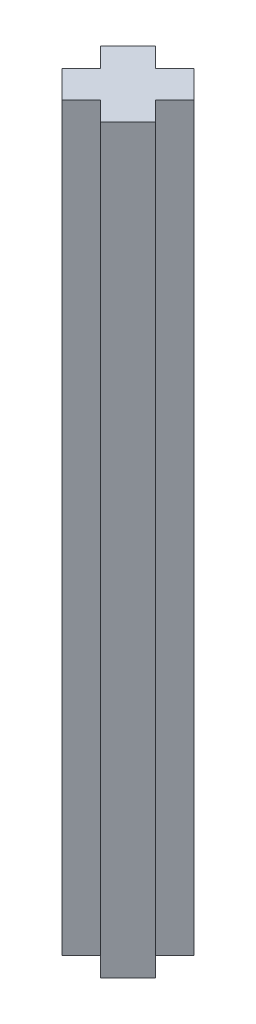
from build123d import *

# Parameters (mm, degrees)
BOSS_EXTRUDE1_DEPTH = 69.02173913
SCALE1_SCALE        = 0.92


with BuildPart() as part:
    # Sketch1 → Boss-Extrude1 (new body)
    with BuildSketch(Plane(origin=(0, 0, 0), x_dir=(1, 0, 0), z_dir=(0, 1, 0))):
        Polygon((-0.6269783, 2.91618698), (-2.423029524, 4.712238204), (-4.963029524, 2.172238204), (-3.1669783, 0.37618698), (-4.963029524, -1.419864244), (-2.423029524, -3.959864244), (-0.6269783, -2.16381302), (1.169072924, -3.959864244), (3.709072924, -1.419864244), (1.9130217, 0.37618698), (3.709072924, 2.172238204), (1.169072924, 4.712238204), align=None)
    extrude(amount=BOSS_EXTRUDE1_DEPTH)


with BuildPart() as part_1:
    # Scale1: scaled about (-0.6269783, 34.510869565, -0.37618698)
    add(part.part.scale(SCALE1_SCALE).moved(Location((-0.050158264, 2.760869565, -0.030094958))))


solid = part_1.part
